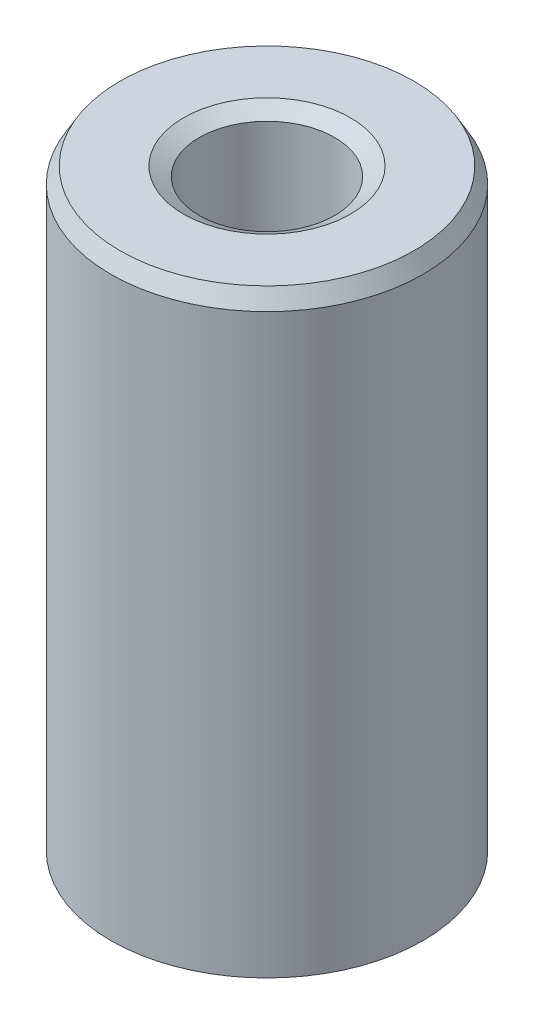
from build123d import *
from OCP.BRepFilletAPI import BRepFilletAPI_MakeChamfer

# Parameters (mm, degrees)
SKETCH1_R           = 17.5
BOSS_EXTRUDE1_DEPTH = 67.498482087
SKETCH2_R           = 7.587177675
CUT_EXTRUDE1_DEPTH  = 72.892594083
CHAMFER1_SIZE       = 1.775842206
CHAMFER1_SIZE2      = 1.025282976


with BuildPart() as part:
    # Sketch1 → Boss-Extrude1 (new body)
    with BuildSketch(Plane(origin=(0, 0, 0), x_dir=(1, 0, 0), z_dir=(0, 1, 0))):
        Circle(SKETCH1_R)
    extrude(amount=BOSS_EXTRUDE1_DEPTH)

    # Sketch2 → Cut-Extrude1 (cut, through all)
    with BuildSketch(Plane(origin=(0, 0, 0), x_dir=(1, 0, 0), z_dir=(0, 1, 0))):
        Circle(SKETCH2_R)
    extrude(amount=CUT_EXTRUDE1_DEPTH, mode=Mode.SUBTRACT)

    # Chamfer1: one chamfer whose edges measure the first distance from different faces: ONE call of the kernel's chamfer builder (chamfer() names one face for all edges)
    chamfer1_edges_1 = [part.edges().sort_by_distance(p)[0] for p in [
        (-7.587177675, 67.498482087, 0),
    ]]
    chamfer1_side_1 = [part.faces().sort_by_distance(p)[0] for p in [
        (-17.005025253, 67.498482087, 0),
    ]]
    chamfer1_edges_2 = [part.edges().sort_by_distance(p)[0] for p in [
        (-7.587177675, 0, 0),
    ]]
    chamfer1_side_2 = [part.faces().sort_by_distance(p)[0] for p in [
        (-7.587177675, 33.749241043, 0),
    ]]
    chamfer1_edges_3 = [part.edges().sort_by_distance(p)[0] for p in [
        (-17.5, 0, 0),
    ]]
    chamfer1_side_3 = [part.faces().sort_by_distance(p)[0] for p in [
        (-17.005025253, 0, 0),
    ]]
    chamfer1_edges_4 = [part.edges().sort_by_distance(p)[0] for p in [
        (-17.5, 67.498482087, 0),
    ]]
    chamfer1_side_4 = [part.faces().sort_by_distance(p)[0] for p in [
        (-17.5, 33.749241043, 0),
    ]]
    chamfer1 = BRepFilletAPI_MakeChamfer(part.part.solid().wrapped)
    for e in chamfer1_edges_1:
        chamfer1.Add(CHAMFER1_SIZE, CHAMFER1_SIZE2, e.wrapped, chamfer1_side_1[0].wrapped)  # the first distance lies on this face
    for e in chamfer1_edges_2:
        chamfer1.Add(CHAMFER1_SIZE, CHAMFER1_SIZE2, e.wrapped, chamfer1_side_2[0].wrapped)  # the first distance lies on this face
    for e in chamfer1_edges_3:
        chamfer1.Add(CHAMFER1_SIZE, CHAMFER1_SIZE2, e.wrapped, chamfer1_side_3[0].wrapped)  # the first distance lies on this face
    for e in chamfer1_edges_4:
        chamfer1.Add(CHAMFER1_SIZE, CHAMFER1_SIZE2, e.wrapped, chamfer1_side_4[0].wrapped)  # the first distance lies on this face
    add(Compound.cast(chamfer1.Shape()), mode=Mode.REPLACE)


solid = part.part
